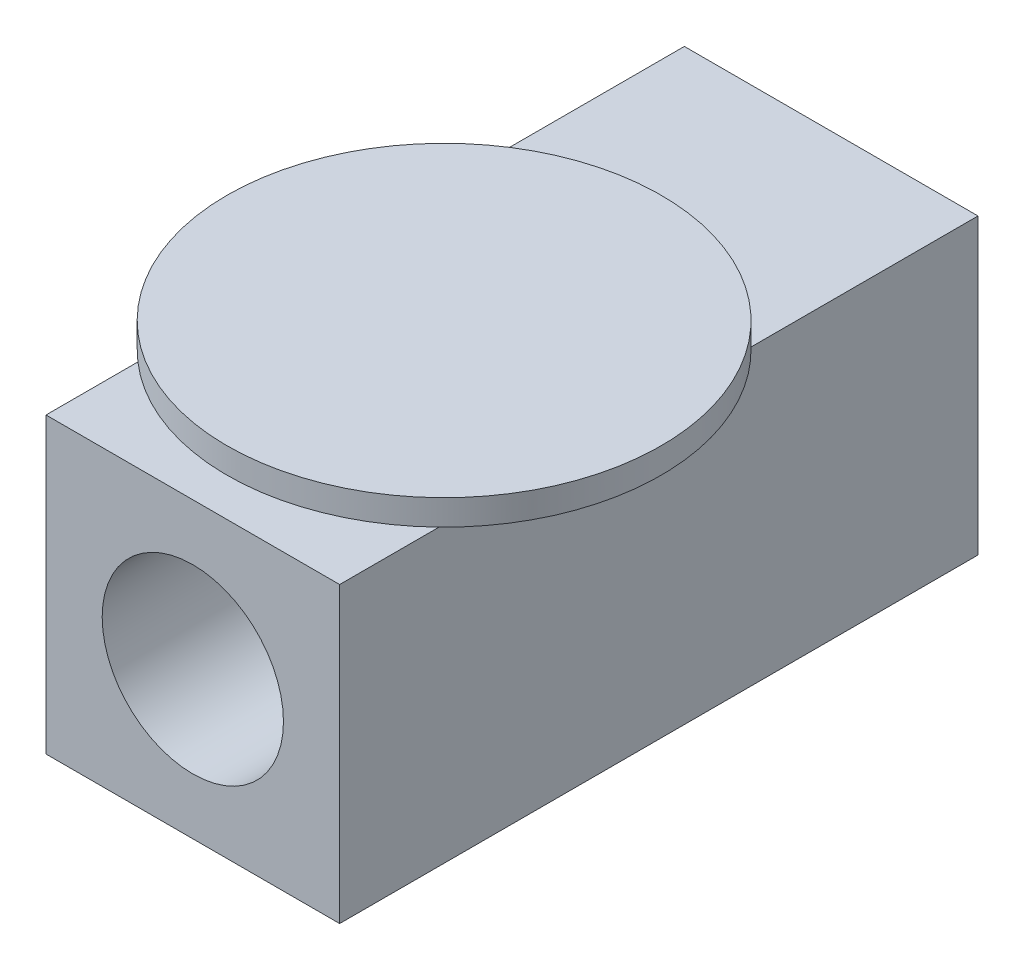
from build123d import *

# Parameters (mm, degrees)
SCHIZZO1_W                   = 23
SCHIZZO1_H                   = 23
ESTRUSIONE_ESTRUSIONE1_DEPTH = 50
TAGLIO_ESTRUSIONE12_REACH    = 56.012
SCHIZZO18_R                  = 7.1
SMUSSO4_SIZE                 = 1
SMUSSO4_SIZE2                = 3
SCHIZZO3_R                   = 17
ESTRUSIONE_ESTRUSIONE2_DEPTH = 2


with BuildPart() as part:
    # Schizzo1 → Estrusione-Estrusione1 (new body)
    with BuildSketch(Plane.XY):
        with Locations((-3.551080126, 2.313028552)):
            Rectangle(SCHIZZO1_W, SCHIZZO1_H)
    extrude(amount=ESTRUSIONE_ESTRUSIONE1_DEPTH)

    # Schizzo18 → Taglio-Estrusione12 (cut, up to next)
    with BuildSketch(Plane(origin=(0, 0, 0), x_dir=(-1, 0, 0), z_dir=(0, 0, -1)), mode=Mode.PRIVATE) as taglio_estrusione12_sk1:
        with Locations((3.551080126, 2.313028552)):
            Circle(SCHIZZO18_R)
    taglio_estrusione12_tool1 = extrude(taglio_estrusione12_sk1.sketch, amount=-TAGLIO_ESTRUSIONE12_REACH, mode=Mode.PRIVATE) & part.part
    add(taglio_estrusione12_tool1.solids().sort_by_distance((-3.55108, 2.313029, 0))[0], mode=Mode.SUBTRACT)

    # Smusso4
    smusso4_edges = [part.edges().sort_by_distance(p)[0] for p in [
        (3.548919874, 2.313028552, 0),
    ]]
    smusso4_side = [part.faces().sort_by_distance(p)[0] for p in [
        (-3.551080126, -8.861702329, 0),
    ]]
    chamfer(smusso4_edges, length=SMUSSO4_SIZE, length2=SMUSSO4_SIZE2, reference=smusso4_side[0])

    # Schizzo3 → Estrusione-Estrusione2 (add)
    with BuildSketch(Plane(origin=(0, 13.813028552, 0), x_dir=(1, 0, 0), z_dir=(0, 1, 0))):
        with Locations((-3.869028742, -30)):
            Circle(SCHIZZO3_R)
    extrude(amount=ESTRUSIONE_ESTRUSIONE2_DEPTH)


solid = part.part
